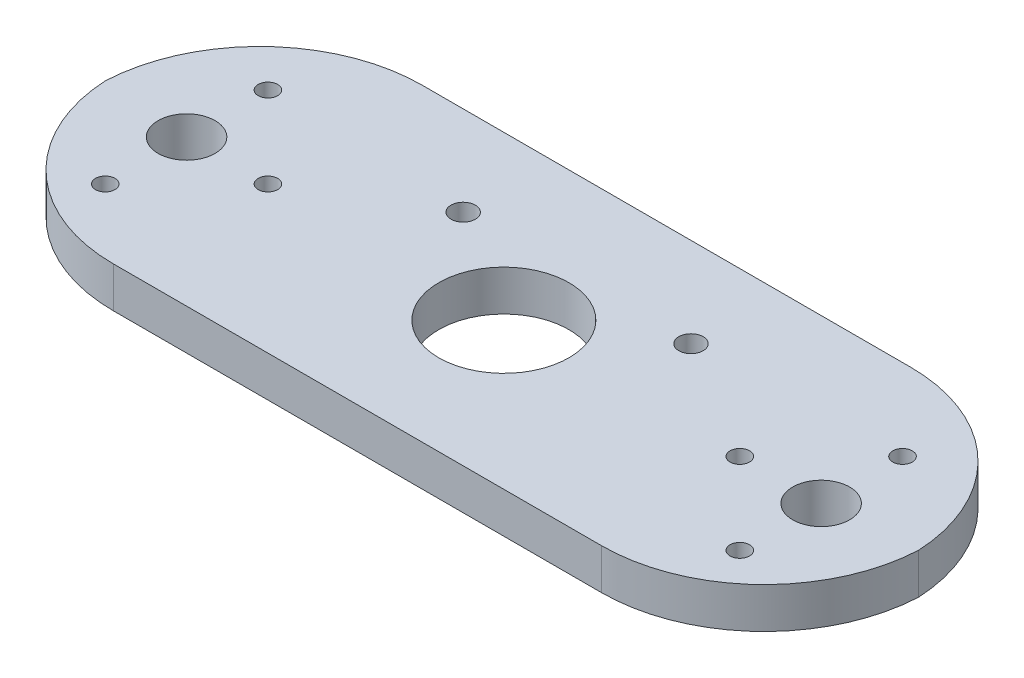
from build123d import *

# Parameters (mm, degrees)
SKETCH_1_W          = 100
SKETCH_1_H          = 38
SKETCH_1_R          = 8
SKETCH_1_R_2        = 3.5
EXTRUDE_1_DEPTH     = 5
FILLET_1_R          = 20
MM_TRANSITIONAL_1_D = 3
HOLE_WIZARD_M2_1_D  = 2.4


with BuildPart() as part:
    # 草图1 → 凸台-拉伸1 (new body)
    with BuildSketch(Plane(origin=(0, 0, 0), x_dir=(1, 0, 0), z_dir=(0, 1, 0))):
        with Locations((0, 1)):
            Rectangle(SKETCH_1_W, SKETCH_1_H)
        with Locations(Location((0, 0, 0), (0, 0, 270))):
            Circle(SKETCH_1_R, mode=Mode.SUBTRACT)
        with Locations(Location((39, 0, 0), (0, 0, 270))):
            Circle(SKETCH_1_R_2, mode=Mode.SUBTRACT)
        with Locations(Location((-39, 0, 0), (0, 0, 90))):
            Circle(SKETCH_1_R_2, mode=Mode.SUBTRACT)
    extrude(amount=EXTRUDE_1_DEPTH)

    # 圆角1
    # the kernel refuses this fillet: 20 mm, written as the material it takes off along each edge
    with BuildSketch(Plane(origin=(-50, -50, -20), x_dir=(1, 0, 0), z_dir=(0, 1, 0))) as fillet_1_piece_1:
        with BuildLine():
            CenterArc((FILLET_1_R, -FILLET_1_R), FILLET_1_R, 90, 90)
            Line((0, -FILLET_1_R), (0, 0))
            Line((0, 0), (FILLET_1_R, 0))
        make_face()
    extrude(amount=105, mode=Mode.SUBTRACT)
    with BuildSketch(Plane(origin=(-50, -50, 18), x_dir=(1, 0, 0), z_dir=(0, 1, 0)), Plane(origin=(50, -50, -20), x_dir=(-1, 0, 0), z_dir=(0, 1, 0)), Plane(origin=(50, -50, 18), x_dir=(0, 0, -1), z_dir=(0, 1, 0))) as fillet_1_piece_2:
        with BuildLine():
            CenterArc((FILLET_1_R, FILLET_1_R), FILLET_1_R, 180, 90)
            Line((0, FILLET_1_R), (0, 0))
            Line((0, 0), (FILLET_1_R, 0))
        make_face()
    extrude(amount=105, mode=Mode.SUBTRACT)

    # 大小mm Transitional 暗销孔1 (through all)
    with Locations(Plane(origin=(0, 5, 0), x_dir=(1, 0, 0), z_dir=(0, 1, 0))):
        with Locations((14, 9), (-14, 9)):
            Hole(MM_TRANSITIONAL_1_D / 2)

    # M2 间隙孔1 (through all)
    with Locations(Plane.ZX.offset(5)):
        with Locations((-10, 39), (10, 39), (0, 29)):
            hole_wizard_m2_1 = Hole(HOLE_WIZARD_M2_1_D / 2)

    # 镜向1: M2 间隙孔1 across plane
    add(hole_wizard_m2_1.mirror(Plane(origin=(0, 0, 0), x_dir=(0, 0, 1), z_dir=(1, 0, 0))), mode=Mode.SUBTRACT)


solid = part.part
